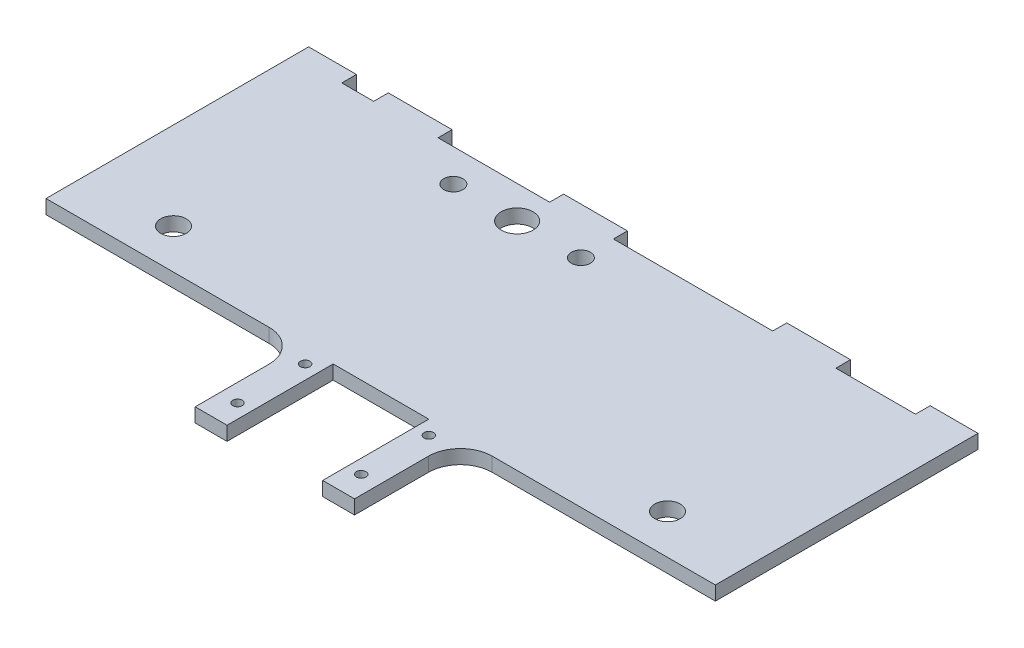
from build123d import *

# Parameters (mm, degrees)
BOSS_EXTRUDE1_DEPTH   = 5.588
CUT_EXTRUDE1_REACH    = 300.407
SKETCH5_R             = 5.08
CUT_EXTRUDE2_REACH    = 300.407
SKETCH6_R             = 6.35
CUT_EXTRUDE3_REACH    = 300.407
SKETCH7_R             = 3.81
F_6_CLEARANCE_HOLE1_D = 3.7973


with BuildPart() as part:
    # Sketch1 → Boss-Extrude1 (new body)
    with BuildSketch(Plane(origin=(0, 0, 0), x_dir=(1, 0, 0), z_dir=(0, 1, 0))):
        with BuildLine():
            Line((12.7, 104.648), (31.75, 104.648))
            Line((31.75, 104.648), (31.75, 98.806))
            Line((31.75, 98.806), (44.45, 98.806))
            Line((44.45, 98.806), (44.45, 104.648))
            Line((44.45, 104.648), (69.85, 104.648))
            Line((69.85, 104.648), (69.85, 99.06))
            Line((69.85, 99.06), (114.3, 99.06))
            Line((114.3, 99.06), (114.3, 104.648))
            Line((114.3, 104.648), (139.7, 104.648))
            Line((139.7, 104.648), (139.7, 99.06))
            Line((139.7, 99.06), (203.2, 99.06))
            Line((203.2, 99.06), (203.2, 104.648))
            Line((203.2, 104.648), (228.6, 104.648))
            Line((228.6, 104.648), (228.6, 98.806))
            Line((228.6, 98.806), (260.35, 98.806))
            Line((260.35, 98.806), (260.35, 104.648))
            Line((260.35, 104.648), (279.4, 104.648))
            Line((279.4, 104.648), (279.4, 0))
            Line((279.4, 0), (190.5, 0))
            ThreePointArc((190.5, 0), (181.519743879, -3.719743879), (177.8, -12.7))
            Line((177.8, -12.7), (177.8, -42.164))
            Line((177.8, -42.164), (165.1, -42.164))
            Line((165.1, -42.164), (165.1, 0.122766638))
            Line((165.1, 0.122766638), (146.05, 0.122766638))
            Line((146.05, 0.122766638), (127, 0.122766638))
            Line((127, 0.122766638), (127, -42.164))
            Line((127, -42.164), (114.3, -42.164))
            Line((114.3, -42.164), (114.3, -12.7))
            ThreePointArc((114.3, -12.7), (110.580256121, -3.719743879), (101.6, 0))
            Line((101.6, 0), (12.7, 0))
            Line((12.7, 0), (12.7, 104.648))
        make_face()
    extrude(amount=BOSS_EXTRUDE1_DEPTH)

    # Sketch5 → Cut-Extrude1 (cut, up to next)
    with BuildSketch(Plane(origin=(0, 5.588, 0), x_dir=(1, 0, 0), z_dir=(0, 1, 0)), mode=Mode.PRIVATE) as cut_extrude1_sk1:
        with Locations((244.475, 15.870766638)):
            Circle(SKETCH5_R)
    cut_extrude1_tool1 = extrude(cut_extrude1_sk1.sketch, amount=-CUT_EXTRUDE1_REACH, mode=Mode.PRIVATE) & part.part
    # Sketch5 → Cut-Extrude1 (cut, up to next)
    with BuildSketch(Plane(origin=(0, 5.588, 0), x_dir=(1, 0, 0), z_dir=(0, 1, 0)), mode=Mode.PRIVATE) as cut_extrude1_sk2:
        with Locations((47.625, 15.870766638)):
            Circle(SKETCH5_R)
    cut_extrude1_tool2 = extrude(cut_extrude1_sk2.sketch, amount=-CUT_EXTRUDE1_REACH, mode=Mode.PRIVATE) & part.part
    add(cut_extrude1_tool1.solids().sort_by_distance((244.475, 5.588, -15.870767))[0], mode=Mode.SUBTRACT)
    add(cut_extrude1_tool2.solids().sort_by_distance((47.625, 5.588, -15.870767))[0], mode=Mode.SUBTRACT)

    # Sketch6 → Cut-Extrude2 (cut, up to next)
    with BuildSketch(Plane.XZ, mode=Mode.PRIVATE) as cut_extrude2_sk1:
        with Locations((114.3, -86.106)):
            Circle(SKETCH6_R)
    cut_extrude2_tool1 = extrude(cut_extrude2_sk1.sketch, amount=-CUT_EXTRUDE2_REACH, mode=Mode.PRIVATE) & part.part
    add(cut_extrude2_tool1.solids().sort_by_distance((114.3, 0, -86.106))[0], mode=Mode.SUBTRACT)

    # Sketch7 → Cut-Extrude3 (cut, up to next)
    with BuildSketch(Plane(origin=(0, 5.588, 0), x_dir=(1, 0, 0), z_dir=(0, 1, 0)), mode=Mode.PRIVATE) as cut_extrude3_sk1:
        with Locations((139.7, 86.106)):
            Circle(SKETCH7_R)
    cut_extrude3_tool1 = extrude(cut_extrude3_sk1.sketch, amount=-CUT_EXTRUDE3_REACH, mode=Mode.PRIVATE) & part.part
    # Sketch7 → Cut-Extrude3 (cut, up to next)
    with BuildSketch(Plane(origin=(0, 5.588, 0), x_dir=(1, 0, 0), z_dir=(0, 1, 0)), mode=Mode.PRIVATE) as cut_extrude3_sk2:
        with Locations((88.9, 86.106)):
            Circle(SKETCH7_R)
    cut_extrude3_tool2 = extrude(cut_extrude3_sk2.sketch, amount=-CUT_EXTRUDE3_REACH, mode=Mode.PRIVATE) & part.part
    add(cut_extrude3_tool1.solids().sort_by_distance((139.7, 5.588, -86.106))[0], mode=Mode.SUBTRACT)
    add(cut_extrude3_tool2.solids().sort_by_distance((88.9, 5.588, -86.106))[0], mode=Mode.SUBTRACT)

    # #6 Clearance Hole1 (through all)
    with Locations(Plane(origin=(0, 5.588, 0), x_dir=(1, 0, 0), z_dir=(0, 1, 0))):
        with Locations((121.412, -5.456849181), (121.412, -32.397617544), (170.688, -32.397617544), (170.688, -5.456849181)):
            Hole(F_6_CLEARANCE_HOLE1_D / 2)


solid = part.part
